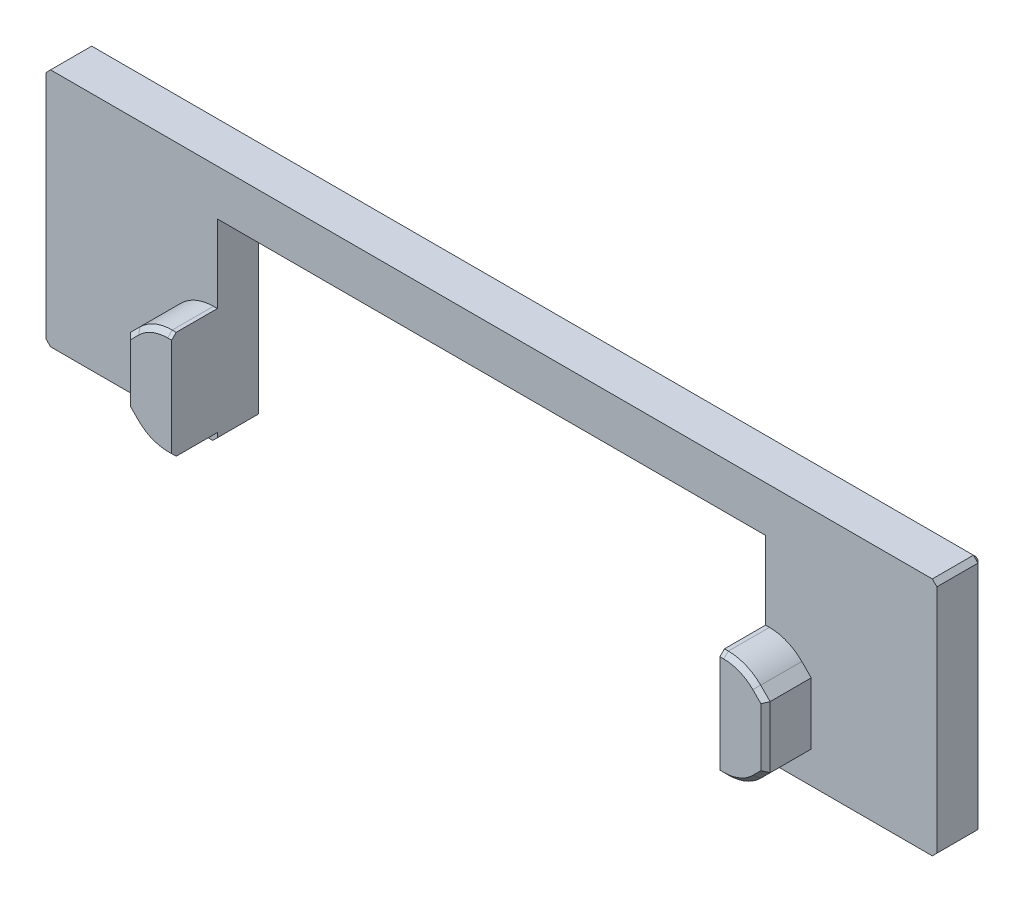
from build123d import *

# Parameters (mm, degrees)
BOSS_EXTRUDE1_DEPTH = 2
BOSS_EXTRUDE3_DEPTH = 2
DEBURS_SIZE         = 0.2


with BuildPart() as part:
    # Sketch1 → Boss-Extrude1 (new body)
    with BuildSketch(Plane.XY):
        Polygon((-19.3, 5.25), (19.3, 5.25), (19.5, 5.05), (19.5, -5.05), (19.3, -5.25), (12.2, -5.25), (12, -5.05), (12, 3.25), (-12, 3.25), (-12, -5.05), (-12.2, -5.25), (-19.3, -5.25), (-19.5, -5.05), (-19.5, 5.05), align=None)
    extrude(amount=-BOSS_EXTRUDE1_DEPTH)

    # Sketch3 → Boss-Extrude3 (add)
    with BuildSketch(Plane.XY):
        with BuildLine():
            Line((12, -0.15), (12, -4.85))
            Line((12, -4.85), (12.171572875, -4.85))
            ThreePointArc((12.171572875, -4.85), (12.93693974, -4.697759065), (13.585786438, -4.264213562))
            Line((13.585786438, -4.264213562), (14, -3.85))
            Line((14, -3.85), (14, -1.15))
            Line((14, -1.15), (13.585786438, -0.735786438))
            ThreePointArc((13.585786438, -0.735786438), (12.93693974, -0.302240935), (12.171572875, -0.15))
            Line((12.171572875, -0.15), (12, -0.15))
        make_face()
    boss_extrude3 = extrude(amount=BOSS_EXTRUDE3_DEPTH)

    # Mirror3: Boss-Extrude3 across plane
    add(boss_extrude3.mirror(Plane(origin=(0, 0, 0), x_dir=(0, 0, 1), z_dir=(1, 0, 0))))

    # Deburs
    deburs_edges = [part.edges().sort_by_distance(p)[0] for p in [
        (12, -0.9, -2),
        (12.1, -5.15, -2),
        (15.75, -5.25, -2),
        (19.4, -5.15, -2),
        (19.5, 0, -2),
        (19.4, 5.15, -2),
        (0, 5.25, -2),
        (-19.4, 5.15, -2),
        (-19.5, 0, -2),
        (-19.4, -5.15, -2),
        (-15.75, -5.25, -2),
        (-12.1, -5.15, -2),
        (-12, -0.9, -2),
        (0, 3.25, -2),
        (-12.085786438, -4.85, 2),
        (-13.792893219, -4.057106781, 2),
        (-12.93693974, -4.697759065, 2),
        (-14, -2.5, 2),
        (-13.792893219, -0.942893219, 2),
        (-12.085786438, -0.15, 2),
        (-12.93693974, -0.302240935, 2),
        (12.085786438, -4.85, 2),
        (13.792893219, -4.057106781, 2),
        (12.93693974, -4.697759065, 2),
        (14, -2.5, 2),
        (13.792893219, -0.942893219, 2),
        (12.085786438, -0.15, 2),
        (12.93693974, -0.302240935, 2),
    ]]
    chamfer(deburs_edges, length=DEBURS_SIZE)


solid = part.part
